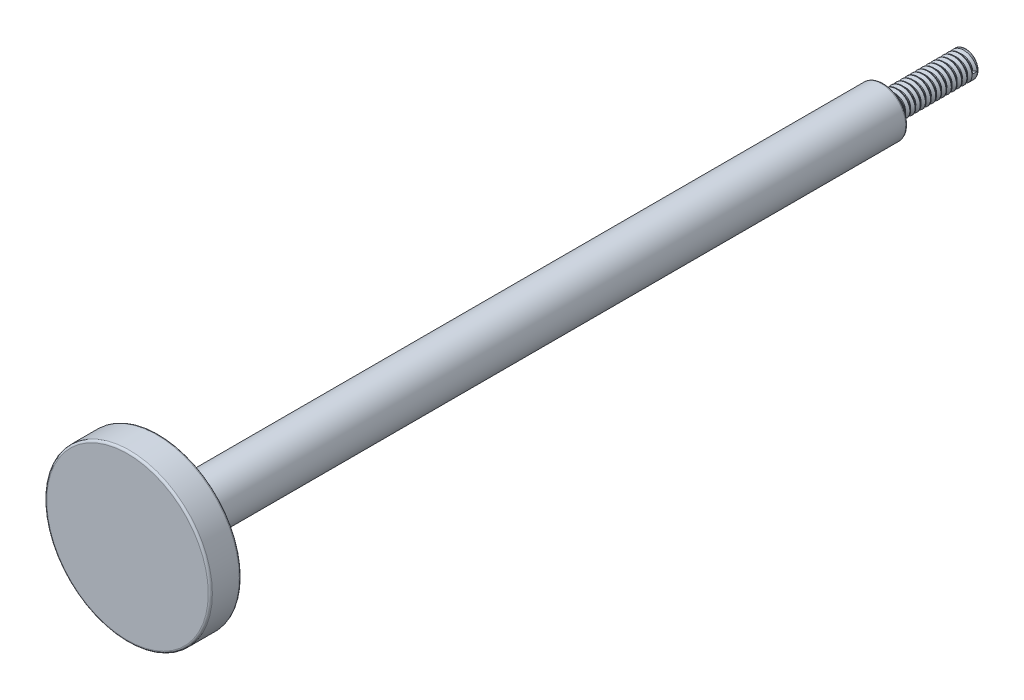
from build123d import *

# Parameters (mm, degrees)
SKETCH1_R           = 2.35
BOSS_EXTRUDE1_DEPTH = 70
SKETCH2_R           = 8
BOSS_EXTRUDE2_DEPTH = 3
SKETCH11_R          = 1.25
BOSS_EXTRUDE3_DEPTH = 8
FILLET1_R           = 0.2
THREAD1_PITCH       = 0.5
FILLET2_R           = 0.2


with BuildPart() as part:
    # Sketch1 → Boss-Extrude1 (new body)
    with BuildSketch(Plane.XY):
        Circle(SKETCH1_R)
    extrude(amount=BOSS_EXTRUDE1_DEPTH)

    # Sketch2 → Boss-Extrude2 (add)
    with BuildSketch(Plane.XY.offset(70)):
        Circle(SKETCH2_R)
    extrude(amount=BOSS_EXTRUDE2_DEPTH)

    # Sketch11 → Boss-Extrude3 (add)
    with BuildSketch(Plane(origin=(0, 0, 0), x_dir=(-1, 0, 0), z_dir=(0, 0, -1))):
        Circle(SKETCH11_R)
    extrude(amount=BOSS_EXTRUDE3_DEPTH)

    # Fillet1
    fillet1_edges = [part.edges().sort_by_distance(p)[0] for p in [
        (1.25, 0, -8),
    ]]
    fillet(fillet1_edges, radius=FILLET1_R)

    # Thread1: the profile of Thread Profile1 profile screwed along a right-hand helix of 15.6 turns, 6 arcs to a turn; built about Z, then put on its axis
    thread1_z = Axis((0, 0, 0), (0, 0, 1))
    thread1_corners = [(1.2503, 0, -0.000173205), (1.2503, 0, 0.437673204), (0.979367063, 0, 0.281249999), (0.979367062, 0, 0.156249999)]
    with BuildLine(mode=Mode.PRIVATE) as thread1_profile:
        Line(thread1_corners[0], thread1_corners[1])
        Line(thread1_corners[1], thread1_corners[2])
        Line(thread1_corners[2], thread1_corners[3])
        Line(thread1_corners[3], thread1_corners[0])
    thread1_cap = Face(thread1_profile.wire())
    thread1_turn_angles = [0, 30, 60, 90, 120, 150, 180, 210, 240, 270, 300, 330, 360]
    thread1_turn_weights = [1, 0.8660254037844387, 1, 0.8660254037844387, 1, 0.8660254037844387, 1, 0.8660254037844387, 1, 0.8660254037844387, 1, 0.8660254037844387, 1]
    thread1_turn_rails = [Edge.make_bspline([Vector(p[0], p[1], 0).rotate(thread1_z, thread1_turn_angles[k]) / thread1_turn_weights[k] + Vector(0, 0, p[2] + THREAD1_PITCH * thread1_turn_angles[k] / 360) for k in range(13)], [0, 0, 0, 1, 1, 2, 2, 3, 3, 4, 4, 5, 5, 6, 6, 6], 2, thread1_turn_weights) for p in thread1_corners]
    thread1_turn_sides = [Face.make_surface_from_curves(thread1_turn_rails[p[0]], thread1_turn_rails[p[1]]) for p in [(0, 1), (1, 2), (2, 3), (3, 0)]]
    thread1_last_angles = [5400, 5430, 5460, 5490, 5520, 5550, 5580, 5598, 5616]
    thread1_last_weights = [1, 0.8660254037844387, 1, 0.8660254037844387, 1, 0.8660254037844387, 1, 0.9510565162951511, 1]
    thread1_last_rails = [Edge.make_bspline([Vector(p[0], p[1], 0).rotate(thread1_z, thread1_last_angles[k]) / thread1_last_weights[k] + Vector(0, 0, p[2] + THREAD1_PITCH * thread1_last_angles[k] / 360) for k in range(9)], [0, 0, 0, 1, 1, 2, 2, 3, 3, 4, 4, 4], 2, thread1_last_weights) for p in thread1_corners]
    thread1_last_sides = [Face.make_surface_from_curves(thread1_last_rails[p[0]], thread1_last_rails[p[1]]) for p in [(0, 1), (1, 2), (2, 3), (3, 0)]]
    thread1 = Plane(origin=(0, 0, -7.8), x_dir=(1, 0, 0), z_dir=(0, 0, 1)) * Solid(Shell([*[p.moved(Location((0, 0, THREAD1_PITCH * i))) for i in range(15) for p in thread1_turn_sides], *thread1_last_sides, thread1_cap, thread1_cap.rotate(thread1_z, 5616).moved(Location((0, 0, THREAD1_PITCH * 5616 / 360)))]))
    add(thread1, mode=Mode.SUBTRACT)

    # Fillet2
    fillet2_edges = [part.edges().sort_by_distance(p)[0] for p in [
        (-2.35, 0, 0),
        (-2.35, 0, 70),
        (-8, 0, 70),
        (-8, 0, 73),
    ]]
    fillet(fillet2_edges, radius=FILLET2_R)


solid = part.part
